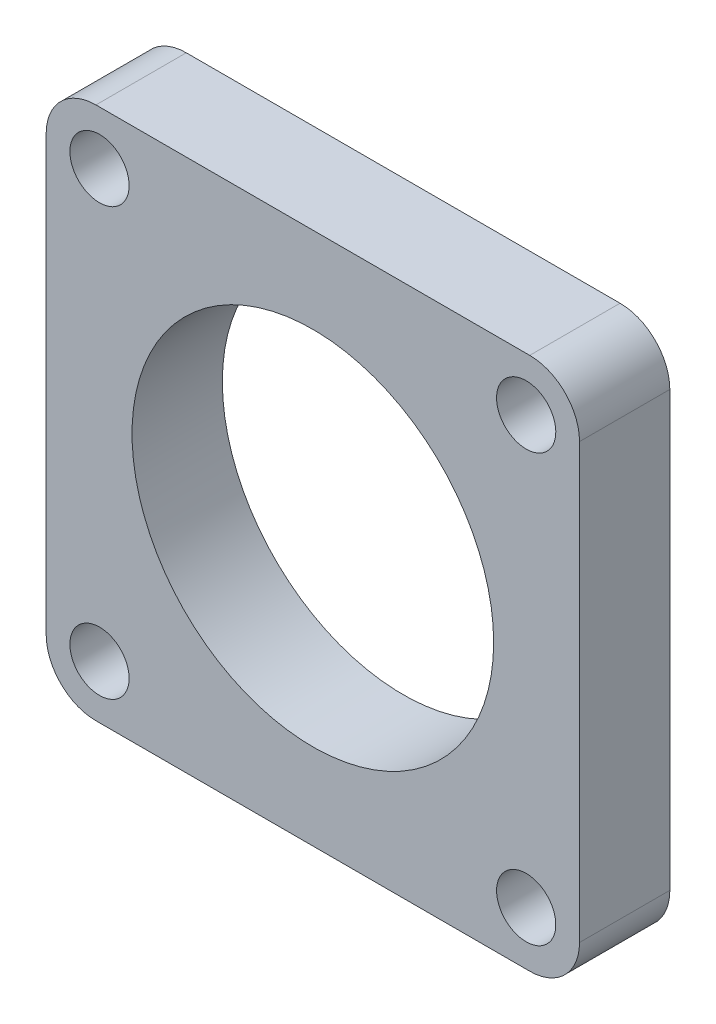
from build123d import *

# Parameters (mm, degrees)
SKETCH1_W           = 75
SKETCH1_H           = 75
BOSS_EXTRUDE1_DEPTH = 12.7
FILLET1_R           = 7
CUT_EXTRUDE1_REACH  = 56.532
SKETCH2_R           = 25.4254
CUT_EXTRUDE2_REACH  = 56.532
SKETCH3_R           = 4.165
CIRPATTERN1_COUNT   = 4


with BuildPart() as part:
    # Sketch1 → Boss-Extrude1 (new body)
    with BuildSketch(Plane.XY):
        Rectangle(SKETCH1_W, SKETCH1_H)
    extrude(amount=BOSS_EXTRUDE1_DEPTH)

    # Fillet1
    fillet1_edges = [part.edges().sort_by_distance(p)[0] for p in [
        (-37.5, -37.5, 6.35),
        (37.5, -37.5, 6.35),
        (-37.5, 37.5, 6.35),
        (37.5, 37.5, 6.35),
    ]]
    fillet(fillet1_edges, radius=FILLET1_R)

    # Sketch2 → Cut-Extrude1 (cut, up to next)
    with BuildSketch(Plane.XY.offset(12.7), mode=Mode.PRIVATE) as cut_extrude1_sk1:
        Circle(SKETCH2_R)
    cut_extrude1_tool1 = extrude(cut_extrude1_sk1.sketch, amount=-CUT_EXTRUDE1_REACH, mode=Mode.PRIVATE) & part.part
    add(cut_extrude1_tool1.solids().sort_by_distance((0, 0, 12.7))[0], mode=Mode.SUBTRACT)

    # Sketch3 → Cut-Extrude2 (cut, up to next)
    with BuildSketch(Plane.XY.offset(12.7), mode=Mode.PRIVATE) as cut_extrude2_sk1:
        with Locations((-30, 30)):
            Circle(SKETCH3_R)
    cut_extrude2_tool1 = extrude(cut_extrude2_sk1.sketch, amount=-CUT_EXTRUDE2_REACH, mode=Mode.PRIVATE) & part.part
    cut_extrude2 = cut_extrude2_tool1.solids().sort_by_distance((-30, 30, 12.7))[0]
    add(cut_extrude2, mode=Mode.SUBTRACT)

    # CirPattern1: Cut-Extrude2 ×4 about axis
    cirpattern1_axis = Axis((0, 0, -0.001), (0, 0, 1))
    for i in range(1, CIRPATTERN1_COUNT):
        add(cut_extrude2.rotate(cirpattern1_axis, i * 360 / CIRPATTERN1_COUNT), mode=Mode.SUBTRACT)


solid = part.part
